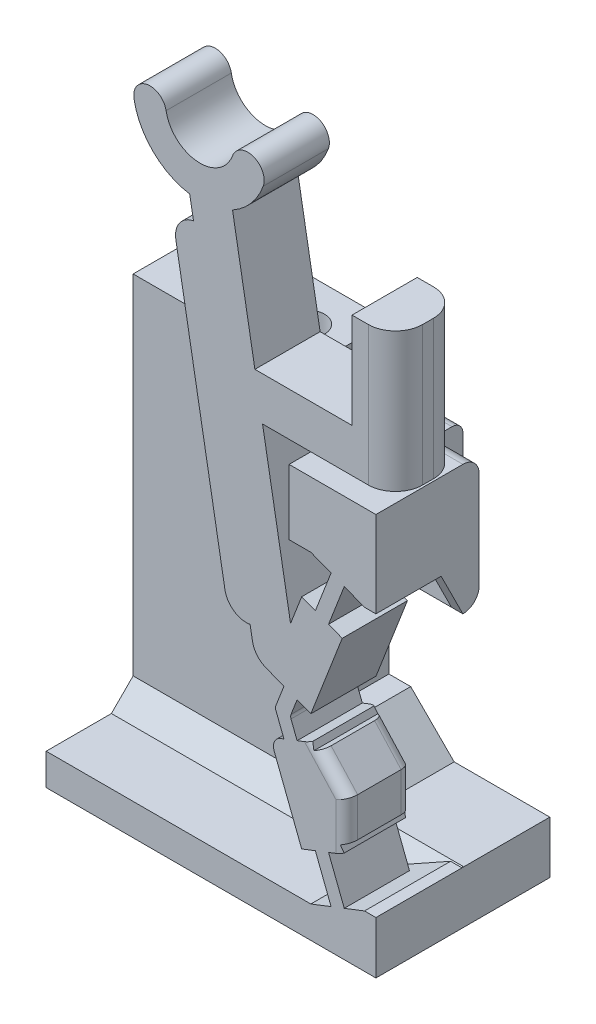
from build123d import *
from OCP.BRepFilletAPI import BRepFilletAPI_MakeChamfer

# Parameters (mm, degrees)
BOSS_SWITCH_BODY_DEPTH                    = 3
SKETCH1_W                                 = 2.994375291
SKETCH1_H                                 = 2.409101515
SKETCH1_W_2                               = 3.994375291
SKETCH1_H_2                               = 3.957767538
BOSS_FLANGE_WIDTH_DEPTH                   = 5
BOSS_FLANGE_HEIGHT_REACH                  = 36.698
SKETCH2_W                                 = 4
SKETCH2_H                                 = 3.957767538
SKETCH2_W_2                               = 8
SKETCH2_H_2                               = 1.451333978
SKETCH17_W                                = 15.1675
SKETCH17_H                                = 4
BOSS_FLANGE_SUPPORT_DEPTH                 = 13.053634428
CUT_WALL_GAP_DEPTH                        = 1
TAP_DRILL_FOR_M2X0_4_TAP1_D               = 1.6
M2_CLEARANCE_HOLE2_D                      = 2.4
M2_CLEARANCE_HOLE2_DEPTH                  = 13.462735941
CHAMFER_FLANGE_SUPPORT_3_SIZE             = 1
FILLET1_R                                 = 1
FILLET2_R                                 = 0.5
SKETCH28_W                                = 6.4
SKETCH28_H                                = 12.095866891
CUT_PRINT_SUPPORT_CLEARANCE_DEPTH         = 33.985789077
CUT_UP_TO_DOWN_DERAILLEUR_CLEARANCE_DEPTH = 8
FILLET3_R                                 = 0.5
FILLET5_R                                 = 1.25
BOSS_EXTRUDE2_DEPTH                       = 2
FILLET7_R                                 = 0.75
SKETCH34_W                                = 1
SKETCH34_H                                = 7.345866891
CUT_EXTRUDE1_DEPTH                        = 4
CHAMFER1_SIZE                             = 2
FILLET9_R                                 = 0.5
BOSS_SUPPORT_CHAMFER_DEPTH                = 0.523509
CHAMFER3_SIZE                             = 0.433012702
CHAMFER3_SIZE_2                           = 0.75
FILLET10_R                                = 0.5


# Some blends are built 0.0001 mm under size
with BuildPart() as part:
    # Sketch-SwitchBossUp → Boss-Switch Body (new body)
    with BuildSketch(Plane.XY):
        with BuildLine():
            Line((-5.697895702, 26.949658376), (-5.524247524, 25.964850623))
            ThreePointArc((-5.524247524, 25.964850623), (-6.169751391, 25.553619307), (-6.3354071, 24.806394693))
            Line((-6.3354071, 24.806394693), (-4.07798079, 12.003893904))
            ThreePointArc((-4.07798079, 12.003893904), (-3.666749473, 11.358390037), (-2.919524859, 11.192734328))
            Line((-2.919524859, 11.192734328), (-2.714625886, 10.030694504))
            Line((-2.714625886, 10.030694504), (-1.992701385, 9.750859132))
            Line((-1.992701385, 9.750859132), (-1.363329725, 9.506899476))
            Line((-1.363329725, 9.506899476), (-1.735258621, 8.547390389))
            ThreePointArc((-1.735258621, 8.547390389), (-1.752158006, 8.457034961), (-1.735258621, 8.366679532))
            Line((-1.735258621, 8.366679532), (-1.363329725, 7.407170445))
            Line((-1.363329725, 7.407170445), (-1.992701385, 7.163210789))
            Line((-1.992701385, 7.163210789), (-0.547014535, 3.433600952))
            Line((-0.547014535, 3.433600952), (0.082357125, 3.677560608))
            Line((0.082357125, 3.677560608), (0.805200549, 1.81275569))
            Line((0.805200549, 1.81275569), (-0.12720191, 1.451333978))
            Line((-0.12720191, 1.451333978), (-0.12720191, 0))
            Line((-0.12720191, 0), (2.867173381, 0))
            Line((2.867173381, 0), (2.867173381, 2.409101515))
            Line((2.867173381, 2.409101515), (2.343664607, 2.409101515))
            Line((2.343664607, 2.409101515), (1.411262148, 2.047679803))
            Line((1.411262148, 2.047679803), (0.688418723, 3.912484721))
            Line((0.688418723, 3.912484721), (1.317790383, 4.156444377))
            Line((1.317790383, 4.156444377), (1.20154386, 4.45633932))
            Line((1.20154386, 4.45633932), (1.527349418, 4.582629423))
            Line((1.527349418, 4.582629423), (1.527349418, 6.382671008))
            Line((1.527349418, 6.382671008), (1.040012528, 6.916747279))
            Line((1.040012528, 6.916747279), (0.305600099, 7.721595547))
            Line((0.305600099, 7.721595547), (-0.015849687, 7.596993847))
            Line((-0.015849687, 7.596993847), (-0.127896466, 7.886054214))
            Line((-0.127896466, 7.886054214), (-0.757268126, 7.642094558))
            Line((-0.757268126, 7.642094558), (-1.038134762, 8.366679532))
            ThreePointArc((-1.038134762, 8.366679532), (-1.055034148, 8.457034961), (-1.038134762, 8.547390389))
            Line((-1.038134762, 8.547390389), (-0.757268126, 9.271975363))
            Line((-0.757268126, 9.271975363), (-0.127896466, 9.028015707))
            Line((-0.127896466, 9.028015707), (1.317790383, 12.757625544))
            Line((1.317790383, 12.757625544), (0.688418723, 13.0015852))
            Line((0.688418723, 13.0015852), (1.411262148, 14.866390118))
            Line((1.411262148, 14.866390118), (2.343664607, 14.504968406))
            Line((2.343664607, 14.504968406), (2.867173381, 14.504968406))
            Line((2.867173381, 14.504968406), (2.867173381, 18.462735944))
            Line((2.867173381, 18.462735944), (-0.111637615, 18.462735944))
            Line((-0.111637615, 18.462735944), (-1.12720191, 18.462735944))
            Line((-1.12720191, 18.462735944), (-1.12720191, 15.462735944))
            Line((-1.12720191, 15.462735944), (-0.12720191, 15.462735944))
            Line((-0.12720191, 15.462735944), (0.805200549, 15.101314231))
            Line((0.805200549, 15.101314231), (0.082357125, 13.236509313))
            Line((0.082357125, 13.236509313), (-0.547014535, 13.480468969))
            Line((-0.547014535, 13.480468969), (-1.059112089, 12.159350171))
            Line((-1.059112089, 12.159350171), (-2.346896051, 19.462735944))
            Line((-2.346896051, 19.462735944), (3.767173381, 19.462735944))
            Line((3.767173381, 19.462735944), (3.767173381, 25.857619356))
            Line((3.767173381, 25.857619356), (1.767173381, 25.857619356))
            Line((1.767173381, 25.857619356), (1.767173381, 21.462735944))
            Line((1.767173381, 21.462735944), (-2.699550012, 21.462735944))
            Line((-2.699550012, 21.462735944), (-3.728280196, 27.296954732))
            ThreePointArc((-3.728280196, 27.296954732), (-2.874356585, 27.992742953), (-2.319025652, 28.944012807))
            ThreePointArc((-2.319025652, 28.944012807), (-2.76728001, 29.905297381), (-3.728564583, 29.457043022))
            ThreePointArc((-3.728564583, 29.457043022), (-5.35868636, 28.418540917), (-6.783708927, 29.724333518))
            ThreePointArc((-6.783708927, 29.724333518), (-7.652550875, 30.332703199), (-8.260920556, 29.463861251))
            ThreePointArc((-8.260920556, 29.463861251), (-7.382425549, 27.795916411), (-5.697895702, 26.949658376))
        make_face()
    extrude(amount=BOSS_SWITCH_BODY_DEPTH)

    # Sketch1 → Boss-Flange Width (add)
    with BuildSketch(Plane(origin=(0, 0, 0), x_dir=(-1, 0, 0), z_dir=(0, 0, -1))):
        with Locations((-1.369985736, 1.204550758)):
            Rectangle(SKETCH1_W, SKETCH1_H)
        with Locations((-0.869985736, 16.483852175)):
            Rectangle(SKETCH1_W_2, SKETCH1_H_2)
    extrude(amount=BOSS_FLANGE_WIDTH_DEPTH)

    # Boss-Flange Height: up to this face of the body (flat: up to its plane)
    boss_flange_height_end = Plane(part.part.faces().sort_by_distance((-0.12720191, 1.077409098, -1.438016547))[0])
    # Sketch2 → Boss-Flange Height (add, up to the picked face)
    with BuildSketch(Plane(origin=(-12.300326619, 0, 0), x_dir=(0, 0, -1), z_dir=(1, 0, 0)), mode=Mode.PRIVATE) as boss_flange_height_sk1:
        with Locations((3, 16.483852175)):
            Rectangle(SKETCH2_W, SKETCH2_H)
    boss_flange_height_tool1 = split(extrude(boss_flange_height_sk1.sketch, amount=BOSS_FLANGE_HEIGHT_REACH, mode=Mode.PRIVATE), bisect_by=boss_flange_height_end, keep=Keep.BOTH, mode=Mode.PRIVATE)
    # Sketch2 → Boss-Flange Height (add, up to the picked face)
    with BuildSketch(Plane(origin=(-12.300326619, 0, 0), x_dir=(0, 0, -1), z_dir=(1, 0, 0)), mode=Mode.PRIVATE) as boss_flange_height_sk2:
        with Locations((1, 0.725666989)):
            Rectangle(SKETCH2_W_2, SKETCH2_H_2)
    boss_flange_height_tool2 = split(extrude(boss_flange_height_sk2.sketch, amount=BOSS_FLANGE_HEIGHT_REACH, mode=Mode.PRIVATE), bisect_by=boss_flange_height_end, keep=Keep.BOTH, mode=Mode.PRIVATE)
    add(boss_flange_height_tool1.solids().sort_by(Axis((-12.300327, 16.483852, -3), (1, 0, 0)))[0])
    add(boss_flange_height_tool2.solids().sort_by(Axis((-12.300327, 0.725667, -1), (1, 0, 0)))[0])

    # Sketch17 → Boss-Flange Support (add)
    with BuildSketch(Plane.XZ.offset(-1.451333978)):
        with Locations((-4.716576619, -3)):
            Rectangle(SKETCH17_W, SKETCH17_H)
    extrude(amount=-BOSS_FLANGE_SUPPORT_DEPTH)

    # Sketch27 → Cut-Wall Gap (cut)
    with BuildSketch(Plane.XY):
        Polygon((-0.12720191, 15.462735944), (2.343664607, 14.504968406), (-1.12720191, 14.504968406), (-1.12720191, 15.462735944), align=None)
        Polygon((2.343664607, 2.409101515), (-0.12720191, 2.409101515), (-0.12720191, 1.451333978), align=None)
    extrude(amount=-CUT_WALL_GAP_DEPTH, mode=Mode.SUBTRACT)

    # Tap Drill for M2x0.4 Tap1 (through all)
    with Locations(Plane(origin=(0, 0, 0), x_dir=(-1, 0, 0), z_dir=(0, -1, 0))):
        with Locations((10.300326619, 3), (6.300326619, 3)):
            Hole(TAP_DRILL_FOR_M2X0_4_TAP1_D / 2)

    # M2 Clearance Hole2
    with Locations(Plane.XZ):
        with Locations((-10.300326619, -3), (-6.300326619, -3)):
            Hole(M2_CLEARANCE_HOLE2_D / 2, depth=M2_CLEARANCE_HOLE2_DEPTH)

    # Chamfer-Flange Support 3
    chamfer_flange_support_3_edges = [part.edges().sort_by_distance(p)[0] for p in [
        (-6.213764264, 1.451333978, -1),
    ]]
    chamfer(chamfer_flange_support_3_edges, length=CHAMFER_FLANGE_SUPPORT_3_SIZE)

    # Fillet1
    fillet1_edges = [part.edges().sort_by_distance(p)[0] for p in [
        (-2.714625886, 10.030694504, 1.5),
    ]]
    fillet(fillet1_edges, radius=FILLET1_R)

    # Fillet2
    fillet2_edges = [part.edges().sort_by_distance(p)[0] for p in [
        (-1.992701385, 7.163210789, 1.5),
    ]]
    fillet(fillet2_edges, radius=FILLET2_R)

    # Sketch28 → Cut-Print Support Clearance (cut, through all)
    with BuildSketch(Plane.XY.offset(-1)):
        with Locations((-0.332826619, 8.457034961)):
            Rectangle(SKETCH28_W, SKETCH28_H)
    extrude(amount=-CUT_PRINT_SUPPORT_CLEARANCE_DEPTH, mode=Mode.SUBTRACT)

    # Sketch12 → Cut-Up-to-Down Derailleur Clearance (cut)
    with BuildSketch(Plane(origin=(0, 18.462735944, 0), x_dir=(1, 0, 0), z_dir=(0, 1, 0))):
        Polygon((2.867173381, 5), (2.867173381, 2.75), (2.867173381, 1.75), (1.117173381, 1.75), (1.117173381, 2.75), (-4.532826619, 2.75), (-4.532826619, 5), align=None)
    extrude(amount=-CUT_UP_TO_DOWN_DERAILLEUR_CLEARANCE_DEPTH, mode=Mode.SUBTRACT)

    # Fillet3
    fillet3_edges = [part.edges().sort_by_distance(p)[0] for p in [
        (1.527349418, 5.482650215, 0),
        (1.527349418, 5.482650215, 3),
        (0.916474758, 7.052133278, 0),
        (0.916474758, 7.052133278, 3),
    ]]
    fillet(fillet3_edges, radius=FILLET3_R)

    # Fillet5
    fillet5_edges = [part.edges().sort_by_distance(p)[0] for p in [
        (3.767173381, 22.66017765, 3),
        (3.767173381, 22.66017765, 0),
    ]]
    fillet(fillet5_edges, radius=FILLET5_R)

    # Sketch32 → Boss-Extrude2 (add)
    with BuildSketch(Plane.XZ.offset(-14.504968406)):
        Polygon((-3.532826619, -2.75), (-3.532826619, -1), (2.867173381, -1), (2.867173381, -1.75), (1.117173381, -1.75), (1.117173381, -2.75), align=None)
    extrude(amount=BOSS_EXTRUDE2_DEPTH)

    # Fillet7
    fillet7_edges = [part.edges().sort_by_distance(p)[0] for p in [
        (1.992173381, 12.504968406, -1.75),
        (1.992173381, 18.462735944, -1.75),
    ]]
    fillet(fillet7_edges, radius=FILLET7_R - 0.0001)  # a hair under: the kernel refuses the full size

    # Sketch34 → Cut-Extrude1 (cut)
    with BuildSketch(Plane(origin=(0, 0, -5), x_dir=(-1, 0, 0), z_dir=(0, 0, -1))):
        with Locations((4.032826619, 8.082034961)):
            Rectangle(SKETCH34_W, SKETCH34_H)
    extrude(amount=-CUT_EXTRUDE1_DEPTH, mode=Mode.SUBTRACT)

    # Chamfer1
    # the kernel refuses this chamfer: 2 mm, written as the material it adds along each edge
    with BuildSketch(Plane(origin=(-3.532826619, 2.409101515, -1), x_dir=(-0.02749587661058627, 0.9996219169112968, 0), z_dir=(0, 0, -1))) as chamfer1_piece_1_section:
        Polygon((CHAMFER1_SIZE * 0.999621916911, CHAMFER1_SIZE * 0.0274958766106), (-CHAMFER1_SIZE * 0.0274958766106, CHAMFER1_SIZE * 0.999621916911), (0, 0), align=None)
    chamfer1_piece_1 = extrude(amount=4, mode=Mode.PRIVATE)
    chamfer1_piece_1 = split(chamfer1_piece_1, bisect_by=Plane(origin=(-2.87201831, 4.409101515, -3), z_dir=(0, -1, 0)), keep=Keep.TOP, mode=Mode.PRIVATE)
    add(chamfer1_piece_1)

    # Fillet9
    fillet9_edges = [part.edges().sort_by_distance(p)[0] for p in [
        (-1.707826619, 18.462735944, -2.75),
        (-1.207826619, 12.504968406, -2.75),
    ]]
    fillet(fillet9_edges, radius=FILLET9_R)

    # Sketch33 → Boss-Support Chamfer (add)
    with BuildSketch(Plane(origin=(2.867173381, 0, 0), x_dir=(0, 0, -1), z_dir=(1, 0, 0))):
        Polygon((1, 14.504968406), (0, 14.504968406), (1, 12.504968406), align=None)
    extrude(amount=-BOSS_SUPPORT_CHAMFER_DEPTH)

    # Chamfer3
    chamfer3_edges_1 = [part.edges().sort_by_distance(p)[0] for p in [
        (-3.532826619, 12.651415015, -2.603553391),
    ]]
    chamfer3_side_1 = [part.faces().sort_by_distance(p)[0] for p in [
        (-3.524166365, 12.651415015, -2.603553391),
    ]]
    chamfer3_edges_2 = [part.edges().sort_by_distance(p)[0] for p in [
        (-3.532826619, 12.504968406, -1.625),
    ]]
    chamfer3_side_2 = [part.faces().sort_by_distance(p)[0] for p in [
        (-3.532826619, 12.496308152, -1.625),
    ]]
    chamfer3 = BRepFilletAPI_MakeChamfer(part.part.solid().wrapped)
    for e in chamfer3_edges_1:
        chamfer3.Add(CHAMFER3_SIZE - 0.0001, CHAMFER3_SIZE_2 - 0.0001, e.wrapped, chamfer3_side_1[0].wrapped)
    for e in chamfer3_edges_2:
        chamfer3.Add(CHAMFER3_SIZE_2 - 0.0001, CHAMFER3_SIZE - 0.0001, e.wrapped, chamfer3_side_2[0].wrapped)
    add(Compound.cast(chamfer3.Shape()), mode=Mode.REPLACE)  # a hair under: the kernel refuses the full size

    # Fillet10
    # the kernel refuses this fillet: 0.5 mm, written as the material it takes off along each edge
    with BuildSketch(Plane(origin=(-2.282826619, 11.754968406, -2.75), x_dir=(0, 1, 0), z_dir=(-1, 0, 0))) as fillet10_piece_1:
        with BuildLine():
            CenterArc((FILLET10_R, -FILLET10_R), FILLET10_R, 90, 90)
            Line((0, -FILLET10_R), (0, 0))
            Line((0, 0), (FILLET10_R, 0))
        make_face()
    extrude(amount=2.25, mode=Mode.SUBTRACT)


solid = part.part
